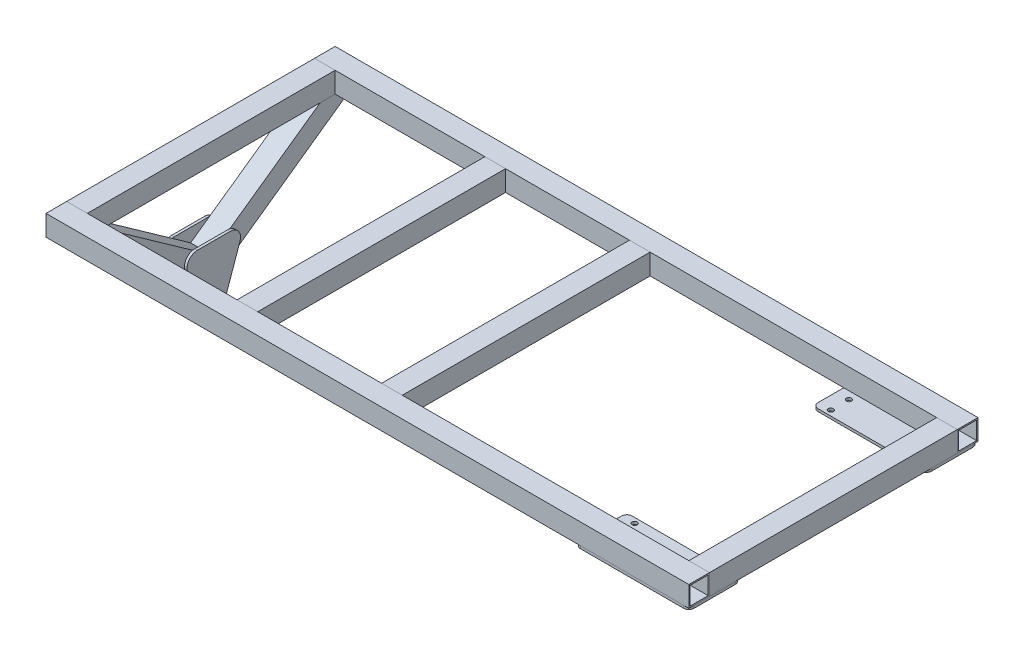
from build123d import *

# Parameters (mm, degrees)
BED_START                       = -12.7
BED_MEMBERS_OUTLINE_W           = 1.651
BED_MEMBERS_OUTLINE_H           = 304.8
BED_MEMBERS_DEPTH               = 25.4
BED_MEMBERS_2_OUTLINE_W         = 22.098
BED_MEMBERS_2_OUTLINE_H         = 304.8
BED_MEMBERS_2_DEPTH             = 1.651
BED_START_2                     = 11.049
BED_MEMBERS_3_OUTLINE_W         = 22.098
BED_MEMBERS_3_OUTLINE_H         = 304.8
BED_MEMBERS_3_DEPTH             = 1.651
BED_START_3                     = -177.8
BED_MEMBERS_4_OUTLINE_W         = 790.575
BED_MEMBERS_4_OUTLINE_H         = 1.651
BED_MEMBERS_4_DEPTH             = 25.4
BED_MEMBERS_5_OUTLINE_W         = 790.575
BED_MEMBERS_5_OUTLINE_H         = 22.098
BED_MEMBERS_5_DEPTH             = 1.651
BED_START_4                     = -154.051
BED_MEMBERS_6_OUTLINE_W         = 790.575
BED_MEMBERS_6_OUTLINE_H         = 22.098
BED_MEMBERS_6_DEPTH             = 1.651
BED_START_5                     = 152.4
BED_MEMBERS_7_OUTLINE_W         = 790.575
BED_MEMBERS_7_OUTLINE_H         = 1.651
BED_MEMBERS_7_DEPTH             = 25.4
BED_MEMBERS_8_OUTLINE_W         = 790.575
BED_MEMBERS_8_OUTLINE_H         = 22.098
BED_MEMBERS_8_DEPTH             = 1.651
BED_START_6                     = 176.149
BED_MEMBERS_9_OUTLINE_W         = 790.575
BED_MEMBERS_9_OUTLINE_H         = 22.098
BED_MEMBERS_9_DEPTH             = 1.651
BED_MEMBERS_10_OUTLINE_W        = 1.651
BED_MEMBERS_10_OUTLINE_H        = 304.8
BED_MEMBERS_10_DEPTH            = 25.4
BED_MEMBERS_11_OUTLINE_W        = 22.098
BED_MEMBERS_11_OUTLINE_H        = 304.8
BED_MEMBERS_11_DEPTH            = 1.651
BED_MEMBERS_12_OUTLINE_W        = 22.098
BED_MEMBERS_12_OUTLINE_H        = 304.8
BED_MEMBERS_12_DEPTH            = 1.651
SKETCH1_W                       = 25.4
SKETCH1_H                       = 25.4
SKETCH1_W_2                     = 22.098
SKETCH1_H_2                     = 22.098
BED_CROSSMEMBERS_DEPTH          = 330.2
SKETCH1_ON_SEGMENT_2_W          = 25.4
SKETCH1_ON_SEGMENT_2_H          = 25.4
SKETCH1_ON_SEGMENT_2_W_2        = 22.098
SKETCH1_ON_SEGMENT_2_H_2        = 22.098
BED_CROSSMEMBERS_2_DEPTH        = 330.2
SKETCH132_W                     = 25.4
SKETCH132_H                     = 25.4
SKETCH132_W_2                   = 22.098
SKETCH132_H_2                   = 22.098
REAR_LEG_MEMBERS_DEPTH          = 240.663092099
SKETCH132_ON_SEGMENT_2_W        = 25.4
SKETCH132_ON_SEGMENT_2_H        = 25.4
SKETCH132_ON_SEGMENT_2_W_2      = 22.098
SKETCH132_ON_SEGMENT_2_H_2      = 22.098
REAR_LEG_MEMBERS_2_DEPTH        = 240.663092099
SKETCH133_W                     = 139.7
SKETCH133_H                     = 63.5
FRONT_LEG_PLATE_DEPTH           = 3.175
FRONT_LEG_PLATE_FILLET_R        = 6.35
SKETCH136_R                     = 3.175
CUT_EXTRUDE1_DEPTH              = 527.633159095
REAR_SUSPENSION_PLATE_DEPTH     = 3.175
REAR_SUSPENSION_PLATE_FILLETS_R = 12.7
SKETCH135_R                     = 6.35
REAR_SUSPENSION_PIVOT_DEPTH     = 831.445592582
TRIM_EXTEND1_START              = -12.7
TRIM_EXTEND1_OUTLINE_W          = 25.4
TRIM_EXTEND1_OUTLINE_H          = 47
TRIM_EXTEND1_DEPTH              = 20.722655011
TRIM_EXTEND1_START_2            = -165.1
TRIM_EXTEND1_2_OUTLINE_W        = 25.4
TRIM_EXTEND1_2_OUTLINE_H        = 25.4
TRIM_EXTEND1_2_OUTLINE_W_2      = 22.098
TRIM_EXTEND1_2_OUTLINE_H_2      = 22.098
TRIM_EXTEND1_2_DEPTH            = 12.7
TRIM_EXTEND1_START_3            = 152.4
TRIM_EXTEND1_3_OUTLINE_W        = 25.4
TRIM_EXTEND1_3_OUTLINE_H        = 25.4
TRIM_EXTEND1_3_OUTLINE_W_2      = 22.098
TRIM_EXTEND1_3_OUTLINE_H_2      = 22.098
TRIM_EXTEND1_3_DEPTH            = 12.7
TRIM_EXTEND1_4_OUTLINE_W        = 25.4
TRIM_EXTEND1_4_OUTLINE_H        = 25.4
TRIM_EXTEND1_4_OUTLINE_W_2      = 22.098
TRIM_EXTEND1_4_OUTLINE_H_2      = 22.098
TRIM_EXTEND1_4_DEPTH            = 12.7
TRIM_EXTEND1_5_OUTLINE_W        = 25.4
TRIM_EXTEND1_5_OUTLINE_H        = 25.4
TRIM_EXTEND1_5_OUTLINE_W_2      = 22.098
TRIM_EXTEND1_5_OUTLINE_H_2      = 22.098
TRIM_EXTEND1_5_DEPTH            = 12.7
TRIM_EXTEND1_6_OUTLINE_W        = 25.4
TRIM_EXTEND1_6_OUTLINE_H        = 47
TRIM_EXTEND1_6_DEPTH            = 20.722655011


# Read off the part's stored shape, not the designer's step: Bed members, Trim/Extend1
with BuildPart() as part:
    # Bed members outline → Bed members (new body)
    with BuildSketch(Plane(origin=(0, 0, 0), x_dir=(1, 0, 0), z_dir=(0, 1, 0)).offset(BED_START)):
        with Locations((478.5995, 0)):
            Rectangle(BED_MEMBERS_OUTLINE_W, BED_MEMBERS_OUTLINE_H)
        with Locations((454.8505, 0)):
            Rectangle(BED_MEMBERS_OUTLINE_W, BED_MEMBERS_OUTLINE_H)
    extrude(amount=BED_MEMBERS_DEPTH)

    # Bed members 2 outline → Bed members 2 (add)
    with BuildSketch(Plane(origin=(0, 0, 0), x_dir=(1, 0, 0), z_dir=(0, 1, 0)).offset(BED_START)):
        with Locations((466.725, 0)):
            Rectangle(BED_MEMBERS_2_OUTLINE_W, BED_MEMBERS_2_OUTLINE_H)
    extrude(amount=BED_MEMBERS_2_DEPTH)

    # Bed members 3 outline → Bed members 3 (add)
    with BuildSketch(Plane(origin=(0, 0, 0), x_dir=(1, 0, 0), z_dir=(0, 1, 0)).offset(BED_START_2)):
        with Locations((466.725, 0)):
            Rectangle(BED_MEMBERS_3_OUTLINE_W, BED_MEMBERS_3_OUTLINE_H)
    extrude(amount=BED_MEMBERS_3_DEPTH)


with BuildPart() as body_2:
    # Bed members 4 outline → Bed members 4 (new body)
    with BuildSketch(Plane.XY.offset(BED_START_3)):
        with Locations((84.1375, 11.8745)):
            Rectangle(BED_MEMBERS_4_OUTLINE_W, BED_MEMBERS_4_OUTLINE_H)
        with Locations((84.1375, -11.8745)):
            Rectangle(BED_MEMBERS_4_OUTLINE_W, BED_MEMBERS_4_OUTLINE_H)
    extrude(amount=BED_MEMBERS_4_DEPTH)

    # Bed members 5 outline → Bed members 5 (add)
    with BuildSketch(Plane.XY.offset(BED_START_3)):
        with Locations((84.1375, 0)):
            Rectangle(BED_MEMBERS_5_OUTLINE_W, BED_MEMBERS_5_OUTLINE_H)
    extrude(amount=BED_MEMBERS_5_DEPTH)

    # Bed members 6 outline → Bed members 6 (add)
    with BuildSketch(Plane.XY.offset(BED_START_4)):
        with Locations((84.1375, 0)):
            Rectangle(BED_MEMBERS_6_OUTLINE_W, BED_MEMBERS_6_OUTLINE_H)
    extrude(amount=BED_MEMBERS_6_DEPTH)


with BuildPart() as body_3:
    # Bed members 7 outline → Bed members 7 (new body)
    with BuildSketch(Plane.XY.offset(BED_START_5)):
        with Locations((84.1375, 11.8745)):
            Rectangle(BED_MEMBERS_7_OUTLINE_W, BED_MEMBERS_7_OUTLINE_H)
        with Locations((84.1375, -11.8745)):
            Rectangle(BED_MEMBERS_7_OUTLINE_W, BED_MEMBERS_7_OUTLINE_H)
    extrude(amount=BED_MEMBERS_7_DEPTH)

    # Bed members 8 outline → Bed members 8 (add)
    with BuildSketch(Plane.XY.offset(BED_START_5)):
        with Locations((84.1375, 0)):
            Rectangle(BED_MEMBERS_8_OUTLINE_W, BED_MEMBERS_8_OUTLINE_H)
    extrude(amount=BED_MEMBERS_8_DEPTH)

    # Bed members 9 outline → Bed members 9 (add)
    with BuildSketch(Plane.XY.offset(BED_START_6)):
        with Locations((84.1375, 0)):
            Rectangle(BED_MEMBERS_9_OUTLINE_W, BED_MEMBERS_9_OUTLINE_H)
    extrude(amount=BED_MEMBERS_9_DEPTH)


with BuildPart() as body_4:
    # Bed members 10 outline → Bed members 10 (new body)
    with BuildSketch(Plane(origin=(0, 0, 0), x_dir=(1, 0, 0), z_dir=(0, 1, 0)).offset(BED_START)):
        with Locations((-310.3245, 0)):
            Rectangle(BED_MEMBERS_10_OUTLINE_W, BED_MEMBERS_10_OUTLINE_H)
        with Locations((-286.5755, 0)):
            Rectangle(BED_MEMBERS_10_OUTLINE_W, BED_MEMBERS_10_OUTLINE_H)
    extrude(amount=BED_MEMBERS_10_DEPTH)

    # Bed members 11 outline → Bed members 11 (add)
    with BuildSketch(Plane(origin=(0, 0, 0), x_dir=(1, 0, 0), z_dir=(0, 1, 0)).offset(BED_START)):
        with Locations((-298.45, 0)):
            Rectangle(BED_MEMBERS_11_OUTLINE_W, BED_MEMBERS_11_OUTLINE_H)
    extrude(amount=BED_MEMBERS_11_DEPTH)

    # Bed members 12 outline → Bed members 12 (add)
    with BuildSketch(Plane(origin=(0, 0, 0), x_dir=(1, 0, 0), z_dir=(0, 1, 0)).offset(BED_START_2)):
        with Locations((-298.45, 0)):
            Rectangle(BED_MEMBERS_12_OUTLINE_W, BED_MEMBERS_12_OUTLINE_H)
    extrude(amount=BED_MEMBERS_12_DEPTH)


with BuildPart() as body_5:
    # Sketch1 → Bed crossmembers (new body)
    with BuildSketch(Plane(origin=(88.9, 0, 165.1), x_dir=(-1, 0, 0), z_dir=(0, 0, -1))):
        Rectangle(SKETCH1_W, SKETCH1_H)
        Rectangle(SKETCH1_W_2, SKETCH1_H_2, mode=Mode.SUBTRACT)
    extrude(amount=BED_CROSSMEMBERS_DEPTH)

    # Trim_Extend1 2 outline → Trim_Extend1 2 (cut)
    with BuildSketch(Plane.XY.offset(TRIM_EXTEND1_START_2)):
        with Locations((88.9, 0)):
            Rectangle(TRIM_EXTEND1_2_OUTLINE_W, TRIM_EXTEND1_2_OUTLINE_H)
        with Locations((88.9, 0)):
            Rectangle(TRIM_EXTEND1_2_OUTLINE_W_2, TRIM_EXTEND1_2_OUTLINE_H_2, mode=Mode.SUBTRACT)
    extrude(amount=TRIM_EXTEND1_2_DEPTH, mode=Mode.SUBTRACT)

    # Trim_Extend1 3 outline → Trim_Extend1 3 (cut)
    with BuildSketch(Plane.XY.offset(TRIM_EXTEND1_START_3)):
        with Locations((88.9, 0)):
            Rectangle(TRIM_EXTEND1_3_OUTLINE_W, TRIM_EXTEND1_3_OUTLINE_H)
        with Locations((88.9, 0)):
            Rectangle(TRIM_EXTEND1_3_OUTLINE_W_2, TRIM_EXTEND1_3_OUTLINE_H_2, mode=Mode.SUBTRACT)
    extrude(amount=TRIM_EXTEND1_3_DEPTH, mode=Mode.SUBTRACT)


with BuildPart() as body_6:
    # Sketch1 on segment 2 (carried to segment 2) → Bed crossmembers 2 (new body)
    with BuildSketch(Plane(origin=(-88.9, 0, 165.1), x_dir=(-1, 0, 0), z_dir=(0, 0, -1))):
        Rectangle(SKETCH1_ON_SEGMENT_2_W, SKETCH1_ON_SEGMENT_2_H)
        Rectangle(SKETCH1_ON_SEGMENT_2_W_2, SKETCH1_ON_SEGMENT_2_H_2, mode=Mode.SUBTRACT)
    extrude(amount=BED_CROSSMEMBERS_2_DEPTH)

    # Trim_Extend1 4 outline → Trim_Extend1 4 (cut)
    with BuildSketch(Plane.XY.offset(TRIM_EXTEND1_START_2)):
        with Locations((-88.9, 0)):
            Rectangle(TRIM_EXTEND1_4_OUTLINE_W, TRIM_EXTEND1_4_OUTLINE_H)
        with Locations((-88.9, 0)):
            Rectangle(TRIM_EXTEND1_4_OUTLINE_W_2, TRIM_EXTEND1_4_OUTLINE_H_2, mode=Mode.SUBTRACT)
    extrude(amount=TRIM_EXTEND1_4_DEPTH, mode=Mode.SUBTRACT)

    # Trim_Extend1 5 outline → Trim_Extend1 5 (cut)
    with BuildSketch(Plane.XY.offset(TRIM_EXTEND1_START_3)):
        with Locations((-88.9, 0)):
            Rectangle(TRIM_EXTEND1_5_OUTLINE_W, TRIM_EXTEND1_5_OUTLINE_H)
        with Locations((-88.9, 0)):
            Rectangle(TRIM_EXTEND1_5_OUTLINE_W_2, TRIM_EXTEND1_5_OUTLINE_H_2, mode=Mode.SUBTRACT)
    extrude(amount=TRIM_EXTEND1_5_DEPTH, mode=Mode.SUBTRACT)


with BuildPart() as body_7:
    # Sketch132 → Rear leg members (new body)
    with BuildSketch(Plane(origin=(-298.45, -2.338672494, 170.45609829), x_dir=(0, 0.8158525595063999, -0.5782599771269463), z_dir=(0, -0.5782599771269463, -0.8158525595063999))):
        Rectangle(SKETCH132_W, SKETCH132_H)
        Rectangle(SKETCH132_W_2, SKETCH132_H_2, mode=Mode.SUBTRACT)
    extrude(amount=REAR_LEG_MEMBERS_DEPTH)

    # Rear leg members mitre 1
    split(bisect_by=Plane(origin=(-298.45, -138.721084, 0), x_dir=(0, -1, 0), z_dir=(0, 0, 1)), keep=Keep.TOP)

    # Trim/Extend1 outline → Trim/Extend1 (cut)
    with BuildSketch(Plane(origin=(0, 0, 0), x_dir=(1, 0, 0), z_dir=(0, 1, 0)).offset(TRIM_EXTEND1_START)):
        with Locations((-298.45, -155.5)):
            Rectangle(TRIM_EXTEND1_OUTLINE_W, TRIM_EXTEND1_OUTLINE_H)
    extrude(amount=TRIM_EXTEND1_DEPTH, mode=Mode.SUBTRACT)


with BuildPart() as body_8:
    # Sketch132 on segment 2 (carried to segment 2) → Rear leg members 2 (new body)
    with BuildSketch(Plane(origin=(-298.45, -141.504506626, 25.889501377), x_dir=(0, 0.81585256, 0.578259977), z_dir=(0, 0.578259977, -0.81585256))):
        Rectangle(SKETCH132_ON_SEGMENT_2_W, SKETCH132_ON_SEGMENT_2_H)
        Rectangle(SKETCH132_ON_SEGMENT_2_W_2, SKETCH132_ON_SEGMENT_2_H_2, mode=Mode.SUBTRACT)
    extrude(amount=REAR_LEG_MEMBERS_2_DEPTH)

    # Rear leg members 2 mitre 1
    split(bisect_by=Plane(origin=(-298.45, -138.721084, 0), x_dir=(0, 1, 0), z_dir=(0, 0, -1)), keep=Keep.TOP)

    # Trim_Extend1 6 outline → Trim_Extend1 6 (cut)
    with BuildSketch(Plane(origin=(0, 0, 0), x_dir=(1, 0, 0), z_dir=(0, 1, 0)).offset(TRIM_EXTEND1_START)):
        with Locations((-298.45, 155.5)):
            Rectangle(TRIM_EXTEND1_6_OUTLINE_W, TRIM_EXTEND1_6_OUTLINE_H)
    extrude(amount=TRIM_EXTEND1_6_DEPTH, mode=Mode.SUBTRACT)


with BuildPart() as body_9:
    # Sketch133 → Front leg plate (new body)
    with BuildSketch(Plane.XZ.offset(12.7)):
        with Locations((409.575, 146.05)):
            Rectangle(SKETCH133_W, SKETCH133_H)
    extrude(amount=FRONT_LEG_PLATE_DEPTH)

    # Front leg plate fillet
    front_leg_plate_fillet_edges = [body_9.edges().sort_by_distance(p)[0] for p in [
        (339.725, -14.2875, 114.3),
        (339.725, -14.2875, 177.8),
        (479.425, -14.2875, 177.8),
        (479.425, -14.2875, 114.3),
    ]]
    fillet(front_leg_plate_fillet_edges, radius=FRONT_LEG_PLATE_FILLET_R)

    # Sketch136 → Cut-Extrude1 (cut, through all)
    with BuildSketch(Plane(origin=(0, -12.7, 0), x_dir=(1, 0, 0), z_dir=(0, 1, 0))):
        with Locations(Location((355.6, -120.65, 0), (0, 0, 180))):
            Circle(SKETCH136_R)
        with Locations(Location((355.6, -142.875, 0), (0, 0, 180))):
            Circle(SKETCH136_R)
        with Locations(Location((441.325, -142.875, 0), (0, 0, 180))):
            Circle(SKETCH136_R)
        with Locations(Location((441.325, -120.65, 0), (0, 0, 180))):
            Circle(SKETCH136_R)
    extrude(amount=-CUT_EXTRUDE1_DEPTH, mode=Mode.SUBTRACT)


with BuildPart() as body_10:
    # Front leg plate mirror: mirrored copy
    add(body_9.part.mirror(Plane.XY))


with BuildPart() as body_11:
    # Sketch134 → Rear suspension plate (new body)
    with BuildSketch(Plane.ZY.offset(311.15)):
        with BuildLine():
            Line((-38.1, -91.096084), (38.1, -91.096084))
            Line((38.1, -91.096084), (14.971827042, -156.699343185))
            ThreePointArc((14.971827042, -156.699343185), (0, -167.296084), (-14.971827042, -156.699343185))
            Line((-14.971827042, -156.699343185), (-38.1, -91.096084))
        make_face()
    extrude(amount=REAR_SUSPENSION_PLATE_DEPTH)

    # Rear suspension plate fillets
    rear_suspension_plate_fillets_edges = [body_11.edges().sort_by_distance(p)[0] for p in [
        (-312.7375, -91.096084, -38.1),
        (-312.7375, -91.096084, 38.1),
    ]]
    fillet(rear_suspension_plate_fillets_edges, radius=REAR_SUSPENSION_PLATE_FILLETS_R)

    # Sketch135 → Rear suspension pivot (cut, through all)
    with BuildSketch(Plane.ZY.offset(314.325)):
        with Locations((0, -151.421084)):
            Circle(SKETCH135_R)
    extrude(amount=-REAR_SUSPENSION_PIVOT_DEPTH, mode=Mode.SUBTRACT)


with BuildPart() as body_12:
    # Rear suspension pivot mirror: mirrored copy
    add(body_11.part.mirror(Plane(origin=(-298.45, 0, 0), x_dir=(0, 0, 1), z_dir=(1, 0, 0))))


solid = Compound([part.part, body_2.part, body_3.part, body_4.part, body_5.part, body_6.part, body_7.part, body_8.part, body_9.part, body_10.part, body_11.part, body_12.part])
